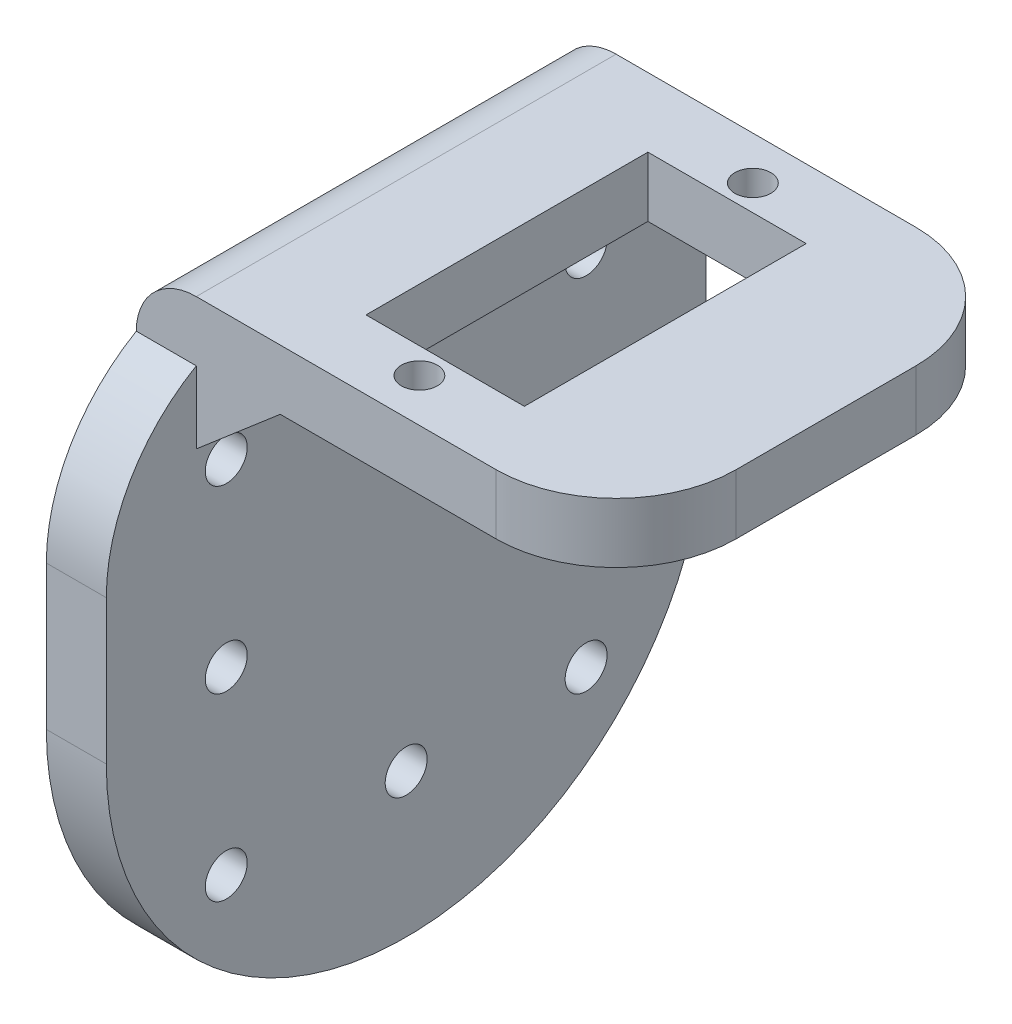
from build123d import *

# Parameters (mm, degrees)
BOSS_EXTRUDE1_DEPTH = 5
CUT_EXTRUDE1_REACH  = 47.346
SKETCH2_R           = 1.75
SKETCH4_W           = 40
SKETCH4_H           = 35
BOSS_EXTRUDE2_DEPTH = 5
CUT_EXTRUDE2_REACH  = 69.454
SKETCH3_R           = 1.5
SKETCH3_W           = 23.5
SKETCH3_H           = 13.2
FILLET1_R           = 10
FILLET2_R           = 5
FILLET4_R           = 15
BOSS_EXTRUDE3_DEPTH = 6


with BuildPart() as part:
    # Sketch1 → Boss-Extrude1 (new body)
    with BuildSketch(Plane(origin=(0, 0, 0), x_dir=(0, 0, -1), z_dir=(1, 0, 0))):
        with BuildLine():
            ThreePointArc((-25, -12.5), (0, -37.5), (25, -12.5))
            Line((25, -12.5), (25, 12.5))
            Line((25, 12.5), (-25, 12.5))
            Line((-25, 12.5), (-25, -12.5))
        make_face()
    extrude(amount=BOSS_EXTRUDE1_DEPTH)

    # Sketch2 → Cut-Extrude1 (cut, up to next)
    with BuildSketch(Plane(origin=(5, 0, 0), x_dir=(0, 0, -1), z_dir=(1, 0, 0)), mode=Mode.PRIVATE) as cut_extrude1_sk1:
        with Locations((-15, -25.5)):
            Circle(SKETCH2_R)
    cut_extrude1_tool1 = extrude(cut_extrude1_sk1.sketch, amount=-CUT_EXTRUDE1_REACH, mode=Mode.PRIVATE) & part.part
    # Sketch2 → Cut-Extrude1 (cut, up to next)
    with BuildSketch(Plane(origin=(5, 0, 0), x_dir=(0, 0, -1), z_dir=(1, 0, 0)), mode=Mode.PRIVATE) as cut_extrude1_sk2:
        with Locations((15, -25.5)):
            Circle(SKETCH2_R)
    cut_extrude1_tool2 = extrude(cut_extrude1_sk2.sketch, amount=-CUT_EXTRUDE1_REACH, mode=Mode.PRIVATE) & part.part
    # Sketch2 → Cut-Extrude1 (cut, up to next)
    with BuildSketch(Plane(origin=(5, 0, 0), x_dir=(0, 0, -1), z_dir=(1, 0, 0)), mode=Mode.PRIVATE) as cut_extrude1_sk3:
        with Locations((-15, 4.5)):
            Circle(SKETCH2_R)
    cut_extrude1_tool3 = extrude(cut_extrude1_sk3.sketch, amount=-CUT_EXTRUDE1_REACH, mode=Mode.PRIVATE) & part.part
    # Sketch2 → Cut-Extrude1 (cut, up to next)
    with BuildSketch(Plane(origin=(5, 0, 0), x_dir=(0, 0, -1), z_dir=(1, 0, 0)), mode=Mode.PRIVATE) as cut_extrude1_sk4:
        with Locations((0, 4.5)):
            Circle(SKETCH2_R)
    cut_extrude1_tool4 = extrude(cut_extrude1_sk4.sketch, amount=-CUT_EXTRUDE1_REACH, mode=Mode.PRIVATE) & part.part
    # Sketch2 → Cut-Extrude1 (cut, up to next)
    with BuildSketch(Plane(origin=(5, 0, 0), x_dir=(0, 0, -1), z_dir=(1, 0, 0)), mode=Mode.PRIVATE) as cut_extrude1_sk5:
        with Locations((15, 4.5)):
            Circle(SKETCH2_R)
    cut_extrude1_tool5 = extrude(cut_extrude1_sk5.sketch, amount=-CUT_EXTRUDE1_REACH, mode=Mode.PRIVATE) & part.part
    # Sketch2 → Cut-Extrude1 (cut, up to next)
    with BuildSketch(Plane(origin=(5, 0, 0), x_dir=(0, 0, -1), z_dir=(1, 0, 0)), mode=Mode.PRIVATE) as cut_extrude1_sk6:
        with Locations((0, -25.5)):
            Circle(SKETCH2_R)
    cut_extrude1_tool6 = extrude(cut_extrude1_sk6.sketch, amount=-CUT_EXTRUDE1_REACH, mode=Mode.PRIVATE) & part.part
    # Sketch2 → Cut-Extrude1 (cut, up to next)
    with BuildSketch(Plane(origin=(5, 0, 0), x_dir=(0, 0, -1), z_dir=(1, 0, 0)), mode=Mode.PRIVATE) as cut_extrude1_sk7:
        with Locations((-15, -10.5)):
            Circle(SKETCH2_R)
    cut_extrude1_tool7 = extrude(cut_extrude1_sk7.sketch, amount=-CUT_EXTRUDE1_REACH, mode=Mode.PRIVATE) & part.part
    # Sketch2 → Cut-Extrude1 (cut, up to next)
    with BuildSketch(Plane(origin=(5, 0, 0), x_dir=(0, 0, -1), z_dir=(1, 0, 0)), mode=Mode.PRIVATE) as cut_extrude1_sk8:
        with Locations((15, -10.5)):
            Circle(SKETCH2_R)
    cut_extrude1_tool8 = extrude(cut_extrude1_sk8.sketch, amount=-CUT_EXTRUDE1_REACH, mode=Mode.PRIVATE) & part.part
    add(cut_extrude1_tool1.solids().sort_by_distance((5, -25.5, 15))[0], mode=Mode.SUBTRACT)
    add(cut_extrude1_tool2.solids().sort_by_distance((5, -25.5, -15))[0], mode=Mode.SUBTRACT)
    add(cut_extrude1_tool3.solids().sort_by_distance((5, 4.5, 15))[0], mode=Mode.SUBTRACT)
    add(cut_extrude1_tool4.solids().sort_by_distance((5, 4.5, 0))[0], mode=Mode.SUBTRACT)
    add(cut_extrude1_tool5.solids().sort_by_distance((5, 4.5, -15))[0], mode=Mode.SUBTRACT)
    add(cut_extrude1_tool6.solids().sort_by_distance((5, -25.5, 0))[0], mode=Mode.SUBTRACT)
    add(cut_extrude1_tool7.solids().sort_by_distance((5, -10.5, 15))[0], mode=Mode.SUBTRACT)
    add(cut_extrude1_tool8.solids().sort_by_distance((5, -10.5, -15))[0], mode=Mode.SUBTRACT)

    # Sketch4 → Boss-Extrude2 (add)
    with BuildSketch(Plane(origin=(0, 12.5, 0), x_dir=(1, 0, 0), z_dir=(0, 1, 0))):
        with Locations((20, 0)):
            Rectangle(SKETCH4_W, SKETCH4_H)
    extrude(amount=BOSS_EXTRUDE2_DEPTH)

    # Sketch3 → Cut-Extrude2 (cut, up to next)
    with BuildSketch(Plane(origin=(30, 17.5, 0), x_dir=(0, 0, -1), z_dir=(0, 1, 0)), mode=Mode.PRIVATE) as cut_extrude2_sk1:
        with Locations(Location((13.9, 10, 0), (0, 0, 180))):
            Circle(SKETCH3_R)
    cut_extrude2_tool1 = extrude(cut_extrude2_sk1.sketch, amount=-CUT_EXTRUDE2_REACH, mode=Mode.PRIVATE) & part.part
    # Sketch3 → Cut-Extrude2 (cut, up to next)
    with BuildSketch(Plane(origin=(30, 17.5, 0), x_dir=(0, 0, -1), z_dir=(0, 1, 0)), mode=Mode.PRIVATE) as cut_extrude2_sk2:
        with Locations(Location((-13.9, 10, 0), (0, 0, 180))):
            Circle(SKETCH3_R)
    cut_extrude2_tool2 = extrude(cut_extrude2_sk2.sketch, amount=-CUT_EXTRUDE2_REACH, mode=Mode.PRIVATE) & part.part
    # Sketch3 → Cut-Extrude2 (cut, up to next)
    with BuildSketch(Plane(origin=(30, 17.5, 0), x_dir=(0, 0, -1), z_dir=(0, 1, 0)), mode=Mode.PRIVATE) as cut_extrude2_sk3:
        with Locations((0, 10)):
            Rectangle(SKETCH3_W, SKETCH3_H)
    cut_extrude2_tool3 = extrude(cut_extrude2_sk3.sketch, amount=-CUT_EXTRUDE2_REACH, mode=Mode.PRIVATE) & part.part
    add(cut_extrude2_tool1.solids().sort_by_distance((20, 17.5, -13.9))[0], mode=Mode.SUBTRACT)
    add(cut_extrude2_tool2.solids().sort_by_distance((20, 17.5, 13.9))[0], mode=Mode.SUBTRACT)
    add(cut_extrude2_tool3.solids().sort_by_distance((20, 17.5, 0))[0], mode=Mode.SUBTRACT)

    # Fillet1
    fillet1_edges = [part.edges().sort_by_distance(p)[0] for p in [
        (40, 15, 17.5),
        (40, 15, -17.5),
    ]]
    fillet(fillet1_edges, radius=FILLET1_R)

    # Fillet2
    fillet2_edges = [part.edges().sort_by_distance(p)[0] for p in [
        (0, 17.5, 0),
    ]]
    fillet(fillet2_edges, radius=FILLET2_R)

    # Fillet4
    # the kernel refuses this fillet: 15 mm, written as the material it takes off along each edge
    with BuildSketch(Plane(origin=(-32.475952642, 12.5, 25), x_dir=(0, 0, -1), z_dir=(1, 0, 0))) as fillet4_piece_1:
        with BuildLine():
            CenterArc((15, -12.990381057), FILLET4_R, 120, 60)
            Line((0, -12.990381057), (-0.3, -12.990381057))
            Line((-0.3, -12.990381057), (-0.3, 0))
            Line((-0.3, 0), (0, 0.3))
            ThreePointArc((0, 0.3), (3.75, 0.3), (7.35, 0.259807621))
            Line((7.35, 0.259807621), (7.5, 0))
        make_face()
    extrude(amount=69.951905284, mode=Mode.SUBTRACT)
    with BuildSketch(Plane(origin=(-32.475952642, 12.5, -25), x_dir=(0, 0, 1), z_dir=(1, 0, 0))) as fillet4_piece_2:
        with BuildLine():
            CenterArc((15, 12.990381057), FILLET4_R, 180, 60)
            Line((0, 12.990381057), (-0.3, 12.990381057))
            Line((-0.3, 12.990381057), (-0.3, 0))
            Line((-0.3, 0), (0, -0.3))
            ThreePointArc((0, -0.3), (3.75, -0.3), (7.35, -0.259807621))
            Line((7.35, -0.259807621), (7.5, 0))
        make_face()
    extrude(amount=69.951905284, mode=Mode.SUBTRACT)

    # Sketch5 → Boss-Extrude3 (add)
    with BuildSketch(Plane(origin=(0, 0, -17.5), x_dir=(-1, 0, 0), z_dir=(0, 0, -1))):
        Polygon((-5, 6.5), (-5, 12.5), (-12, 12.5), align=None)
    boss_extrude3 = extrude(amount=-BOSS_EXTRUDE3_DEPTH)

    # Mirror1: Boss-Extrude3 across plane
    add(boss_extrude3.mirror(Plane.XY))


solid = part.part
